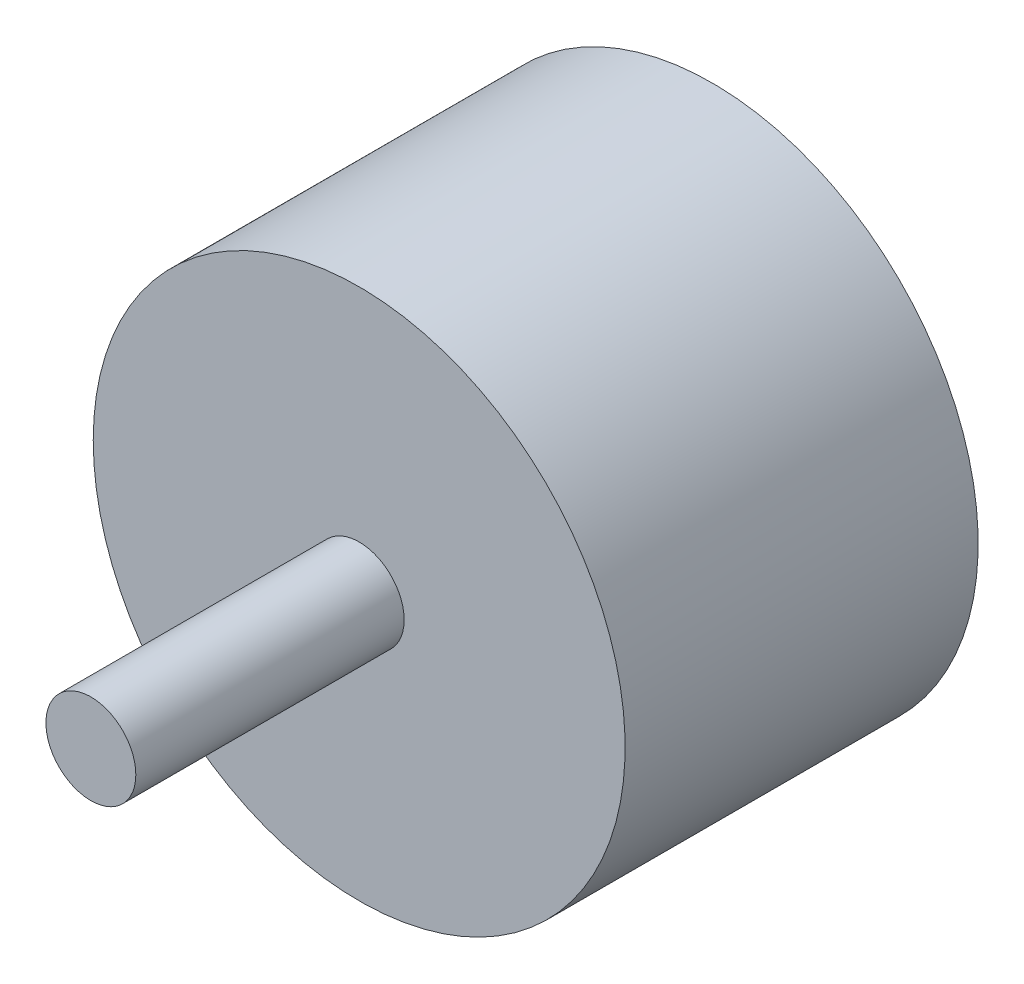
from build123d import *

# Parameters (mm, degrees)
SKETCH1_R           = 14.351
BOSS_EXTRUDE1_DEPTH = 19.05
SKETCH2_R           = 2.4257
BOSS_EXTRUDE2_DEPTH = 14.478
SKETCH3_R           = 1.2065
CUT_EXTRUDE1_DEPTH  = 5.08


with BuildPart() as part:
    # Sketch1 → Boss-Extrude1 (new body)
    with BuildSketch(Plane.XY):
        Circle(SKETCH1_R)
    extrude(amount=BOSS_EXTRUDE1_DEPTH)

    # Sketch2 → Boss-Extrude2 (add)
    with BuildSketch(Plane.XY.offset(19.05)):
        Circle(SKETCH2_R)
    extrude(amount=BOSS_EXTRUDE2_DEPTH)

    # Sketch3 → Cut-Extrude1 (cut)
    with BuildSketch(Plane(origin=(0, 0, 0), x_dir=(-1, 0, 0), z_dir=(0, 0, -1))):
        with Locations((0, 9.652)):
            Circle(SKETCH3_R)
        with Locations((9.652, 0)):
            Circle(SKETCH3_R)
        with Locations((0, -9.652)):
            Circle(SKETCH3_R)
        with Locations((-9.652, 0)):
            Circle(SKETCH3_R)
    extrude(amount=-CUT_EXTRUDE1_DEPTH, mode=Mode.SUBTRACT)


solid = part.part
